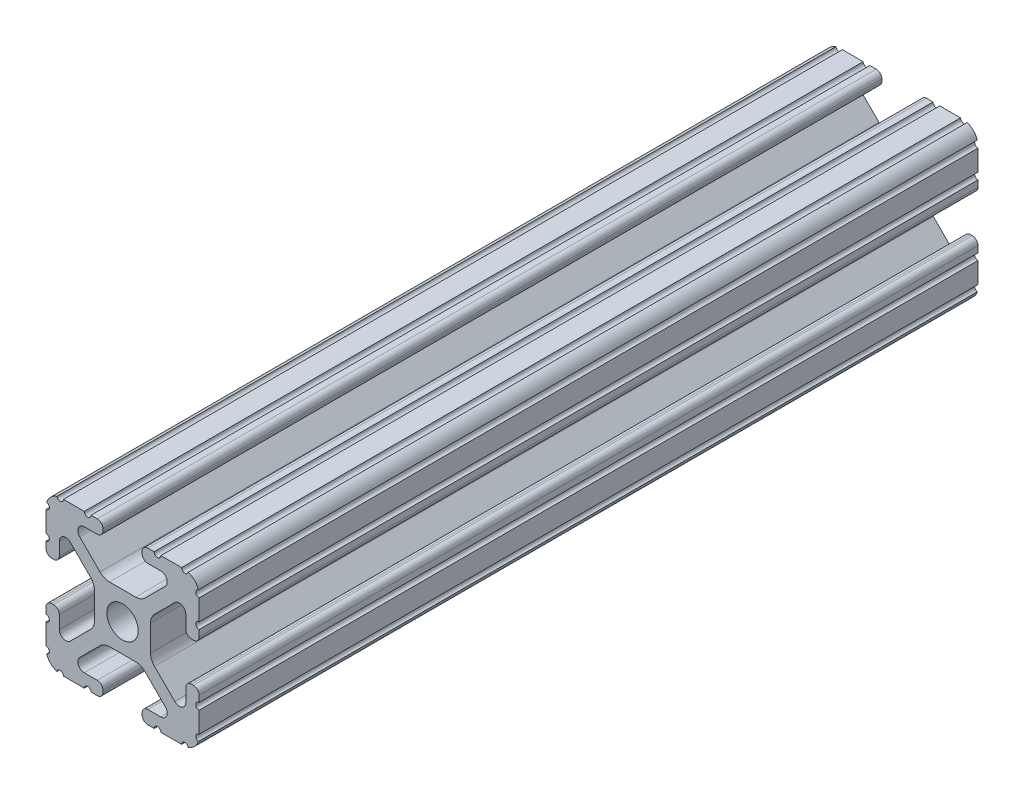
from build123d import *

# Parameters (mm, degrees)
BOSS_EXTRUDE1_DEPTH     = 64.62
CUT_EXTRUDE1_DEPTH      = 68.069548977
CUT_EXTRUDE1_DEPTH_BACK = 68.069548977
SKETCH5_R               = 0.55245


with BuildPart() as part:
    # Sketch4 → Boss-Extrude1 (new, symmetric)
    with BuildSketch(Plane.XY):
        with BuildLine():
            Line((4.190365, -12.7), (10.11729625, -12.7))
            ThreePointArc((10.11729625, -12.7), (11.943543585, -11.943543585), (12.7, -10.11729625))
            Line((12.7, -10.11729625), (12.7, -4.190365))
            ThreePointArc((12.7, -4.190365), (12.42492494, -3.52627506), (11.760835, -3.2512))
            Line((11.760835, -3.2512), (11.429365, -3.2512))
            ThreePointArc((11.429365, -3.2512), (10.76527506, -3.52627506), (10.4902, -4.190365))
            Line((10.4902, -4.190365), (10.4902, -6.348478019))
            ThreePointArc((10.4902, -6.348478019), (9.830707141, -7.335478831), (8.666460301, -7.103895736))
            Line((8.666460301, -7.103895736), (5.299899128, -3.737334563))
            ThreePointArc((5.299899128, -3.737334563), (4.817571085, -3.015479634), (4.6482, -2.16399369))
            Line((4.6482, -2.16399369), (4.6482, 0))
            Line((4.6482, 0), (2.6035, 0))
            ThreePointArc((2.6035, 0), (1.840952505, -1.840952505), (0, -2.6035))
            Line((0, -2.6035), (0, -4.6482))
            Line((0, -4.6482), (2.16399369, -4.6482))
            ThreePointArc((2.16399369, -4.6482), (3.015479634, -4.817571085), (3.737334563, -5.299899128))
            Line((3.737334563, -5.299899128), (7.103895736, -8.666460301))
            ThreePointArc((7.103895736, -8.666460301), (7.335478831, -9.830707141), (6.348478019, -10.4902))
            Line((6.348478019, -10.4902), (4.190365, -10.4902))
            ThreePointArc((4.190365, -10.4902), (3.52627506, -10.76527506), (3.2512, -11.429365))
            Line((3.2512, -11.429365), (3.2512, -11.760835))
            ThreePointArc((3.2512, -11.760835), (3.52627506, -12.42492494), (4.190365, -12.7))
        make_face()
    extrude(amount=BOSS_EXTRUDE1_DEPTH, both=True)

    # Sketch5 → Cut-Extrude1 (cut, two sides: drawn at the far end of the back side and taken through both)
    with BuildSketch(Plane.XY.offset(-CUT_EXTRUDE1_DEPTH_BACK)):
        with Locations((10.356153152, -12.7)):
            Circle(SKETCH5_R)
        with Locations((5.796028019, -12.7)):
            Circle(SKETCH5_R)
        with Locations((12.7, -10.356153152)):
            Circle(SKETCH5_R)
        with Locations((12.7, -5.796028019)):
            Circle(SKETCH5_R)
    extrude(amount=CUT_EXTRUDE1_DEPTH + CUT_EXTRUDE1_DEPTH_BACK, mode=Mode.SUBTRACT)

    # Mirror1: part across plane


with BuildPart() as part_1:
    add(part.part)
    add(part.part.mirror(Plane(origin=(0, 0, 0), x_dir=(0, 0, 1), z_dir=(1, 0, 0))))

    # Mirror2: part across plane


with BuildPart() as part_2:
    add(part_1.part)
    add(part_1.part.mirror(Plane.ZX))


solid = part_2.part
